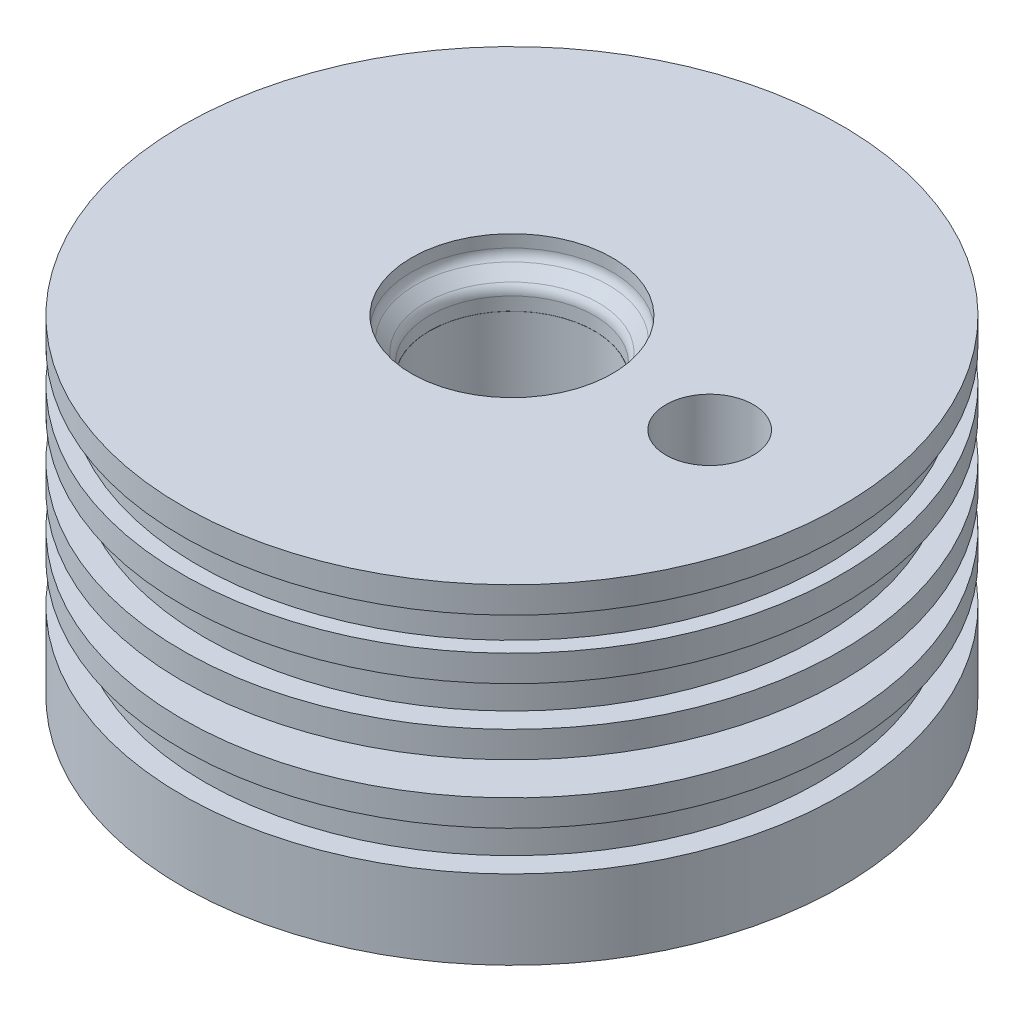
from build123d import *

# Parameters (mm, degrees)
F_5_8_0_625_DIAMETER_HOLE1_D      = 15.875
F_5_8_0_625_DIAMETER_HOLE1_DEPTH  = 21.075168836
F_5_8_0_625_DIAMETER_HOLE1_TIP    = 4.769331164
SKETCH46_W                        = 24.13
SKETCH46_H                        = 3.175
CUT_REVOLVE2_ANGLE                = 255
CUT_REVOLVE2_OTHER_WAY_ANGLE      = 75
PIPE_TAP_DRILL_FOR_1_8_TAP3_D     = 8.4328
PIPE_TAP_DRILL_FOR_1_8_TAP3_DEPTH = 14.605
PIPE_TAP_DRILL_FOR_1_8_TAP3_TIP   = 2.533468714


with BuildPart() as part:
    # Sketch1 → Revolve1 (revolve)
    with BuildSketch(Plane.XY):
        with BuildLine():
            Line((-31.75, 21.9075), (-29.591, 21.9075))
            Line((-29.591, 21.9075), (-29.591, 18.0975))
            Line((-29.591, 18.0975), (-31.75, 18.0975))
            Line((-31.75, 18.0975), (-31.75, 9.8425))
            Line((-31.75, 9.8425), (-29.591, 9.8425))
            Line((-29.591, 9.8425), (-29.591, 6.0325))
            Line((-29.591, 6.0325), (-31.75, 6.0325))
            Line((-31.75, 6.0325), (-31.75, -1.5875))
            Line((-31.75, -1.5875), (-25.4, -1.5875))
            Line((-25.4, -1.5875), (-25.4, 0))
            Line((-25.4, 0), (0, 0))
            Line((0, 0), (0, 24.919397552))
            Line((0, 24.919397552), (-7.9502, 24.919397552))
            Line((-7.9502, 24.919397552), (-7.9502, 26.189397552))
            ThreePointArc((-7.9502, 26.189397552), (-8.046872994, 26.675405511), (-8.322174388, 27.087423164))
            Line((-8.322174388, 27.087423164), (-9.305425612, 28.070674388))
            ThreePointArc((-9.305425612, 28.070674388), (-9.580727006, 28.482692041), (-9.6774, 28.9687))
            Line((-9.6774, 28.9687), (-9.6774, 30.1625))
            Line((-9.6774, 30.1625), (-31.75, 30.1625))
            Line((-31.75, 30.1625), (-31.75, 27.6225))
            Line((-31.75, 27.6225), (-30.226, 27.6225))
            Line((-30.226, 27.6225), (-30.226, 24.4475))
            Line((-30.226, 24.4475), (-31.75, 24.4475))
            Line((-31.75, 24.4475), (-31.75, 21.9075))
        make_face()
    revolve(axis=Axis((0, 24.919397552, 0), (0, -1, 0)))

    # Sketch43 → Cut-Revolve1 (revolve, cut)
    with BuildSketch(Plane.XY):
        Polygon((0, 0), (3.952796538, 0), (4.191, 7.62), (0, 7.62), align=None)
    revolve(axis=Axis((0, 7.62, 0), (0, -1, 0)), mode=Mode.SUBTRACT)

    # 5/8 (0.625) Diameter Hole1
    with Locations(Plane(origin=(0, 30.1625, 0), x_dir=(1, 0, 0), z_dir=(0, 1, 0))):
        with Locations((0, 0)):
            Hole(F_5_8_0_625_DIAMETER_HOLE1_D / 2, depth=F_5_8_0_625_DIAMETER_HOLE1_DEPTH)
            with Locations((0, 0, -(F_5_8_0_625_DIAMETER_HOLE1_DEPTH + F_5_8_0_625_DIAMETER_HOLE1_TIP / 2))):  # 118° drill point
                Cone(0, F_5_8_0_625_DIAMETER_HOLE1_D / 2, F_5_8_0_625_DIAMETER_HOLE1_TIP, mode=Mode.SUBTRACT)

    # Sketch46 → Cut-Revolve2 (revolve, cut)
    with BuildSketch(Plane(origin=(0, 0, 0), x_dir=(0, 0, -1), z_dir=(1, 0, 0))):
        with Locations((19.685, 13.97)):
            Rectangle(SKETCH46_W, SKETCH46_H)
    revolve(axis=Axis((0, 22.2885, 0), (0, -1, 0)), revolution_arc=CUT_REVOLVE2_ANGLE, mode=Mode.SUBTRACT)

    # Sketch46 → Cut-Revolve2 other way (revolve, cut)
    with BuildSketch(Plane(origin=(0, 0, 0), x_dir=(0, 0, -1), z_dir=(1, 0, 0))):
        with Locations((19.685, 13.97)):
            Rectangle(SKETCH46_W, SKETCH46_H)
    revolve(axis=Axis((0, 22.2885, 0), (0, 1, 0)), revolution_arc=CUT_REVOLVE2_OTHER_WAY_ANGLE, mode=Mode.SUBTRACT)

    # Pipe Tap Drill for 1/8 Tap3
    with Locations(Plane(origin=(0, 30.1625, 0), x_dir=(1, 0, 0), z_dir=(0, 1, 0))):
        with Locations((19.05, 0)):
            Hole(PIPE_TAP_DRILL_FOR_1_8_TAP3_D / 2, depth=PIPE_TAP_DRILL_FOR_1_8_TAP3_DEPTH)
            with Locations((0, 0, -(PIPE_TAP_DRILL_FOR_1_8_TAP3_DEPTH + PIPE_TAP_DRILL_FOR_1_8_TAP3_TIP / 2))):  # 118° drill point
                Cone(0, PIPE_TAP_DRILL_FOR_1_8_TAP3_D / 2, PIPE_TAP_DRILL_FOR_1_8_TAP3_TIP, mode=Mode.SUBTRACT)


solid = part.part
